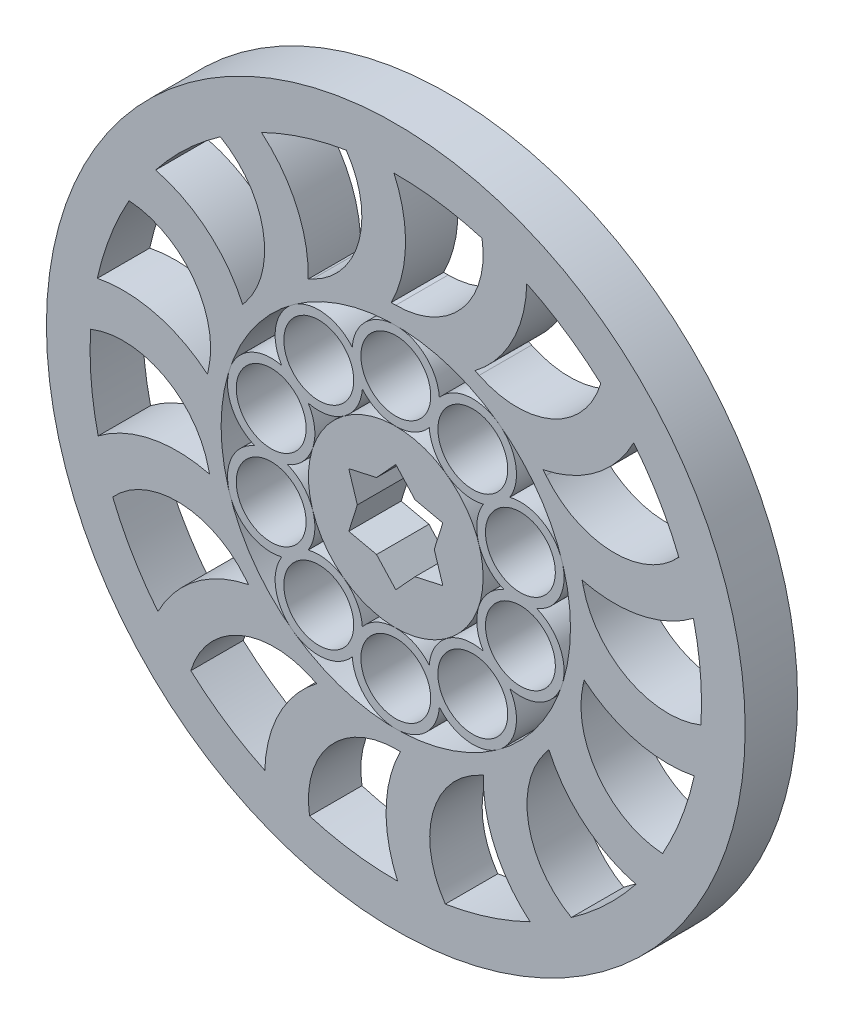
from build123d import *

# Parameters (mm, degrees)
SKETCH2_R           = 10
SKETCH2_R_2         = 1
BOSS_EXTRUDE2_DEPTH = 6
SKETCH3_R           = 5
SKETCH3_R_2         = 4
BOSS_EXTRUDE3_DEPTH = 6
CIRPATTERN1_COUNT   = 10
SKETCH5_R           = 22
SKETCH5_R_2         = 20
BOSS_EXTRUDE4_DEPTH = 6
SKETCH6_R           = 40
SKETCH6_R_2         = 35
BOSS_EXTRUDE5_DEPTH = 6
BOSS_EXTRUDE6_DEPTH = 6
CAVITY1_OUTLINE_R   = 1
CAVITY1_DEPTH       = 6
CUT_EXTRUDE1_DEPTH  = 6


# Read off the part's stored shape, not the designer's step: Cavity1
with BuildPart() as part:
    # Sketch2 → Boss-Extrude2 (new body)
    with BuildSketch(Plane.XY):
        Circle(SKETCH2_R)
        Circle(SKETCH2_R_2, mode=Mode.SUBTRACT)
    extrude(amount=BOSS_EXTRUDE2_DEPTH)

    # Cavity1 outline → Cavity1 (cut)
    with BuildSketch(Plane.XY):
        Polygon((5.127518984, -2.960374466), (4.194116501, 0), (5.127518984, 2.960374466), (2.09705825, 3.632211436), (0, 5.920748932), (-2.09705825, 3.632211436), (-5.127518984, 2.960374466), (-4.194116501, 0), (-5.127518984, -2.960374466), (-2.09705825, -3.632211436), (0, -5.920748932), (2.09705825, -3.632211436), align=None)
        Circle(CAVITY1_OUTLINE_R, mode=Mode.SUBTRACT)
    extrude(amount=CAVITY1_DEPTH, mode=Mode.SUBTRACT)

    # Sketch8 → Cut-Extrude1 (cut)
    # profile 1 of 2: a face of its own
    with BuildSketch(Plane(origin=(0, 0, 0), x_dir=(-1, 0, 0), z_dir=(0, 0, -1))):
        Polygon((5.383894933, -3.108393189), (4.403822326, 0), (5.383894933, 3.108393189), (2.201911163, 3.813822008), (0, 6.216786378), (-2.201911163, 3.813822008), (-5.383894933, 3.108393189), (-4.403822326, 0), (-5.383894933, -3.108393189), (-2.201911163, -3.813822008), (0, -6.216786378), (2.201911163, -3.813822008), align=None)
        Polygon((-2.09705825, -3.632211436), (-5.127518984, -2.960374466), (-4.194116501, 0), (-5.127518984, 2.960374466), (-2.09705825, 3.632211436), (0, 5.920748932), (2.09705825, 3.632211436), (5.127518984, 2.960374466), (4.194116501, 0), (5.127518984, -2.960374466), (2.09705825, -3.632211436), (0, -5.920748932), align=None, mode=Mode.SUBTRACT)
    # profile 2 of 2: a face of its own
    with BuildSketch(Plane(origin=(0, 0, 0), x_dir=(-1, 0, 0), z_dir=(0, 0, -1))):
        Polygon((-5.127518984, -2.960374466), (-4.194116501, 0), (-5.127518984, 2.960374466), (-2.09705825, 3.632211436), (0, 5.920748932), (2.09705825, 3.632211436), (5.127518984, 2.960374466), (4.194116501, 0), (5.127518984, -2.960374466), (2.09705825, -3.632211436), (0, -5.920748932), (-2.09705825, -3.632211436), align=None)
    extrude(amount=-CUT_EXTRUDE1_DEPTH, mode=Mode.SUBTRACT)


with BuildPart() as body_2:
    # Sketch3 → Boss-Extrude3 (new body)
    with BuildSketch(Plane.XY):
        with Locations((0, 15)):
            Circle(SKETCH3_R)
        with Locations((0, 15)):
            Circle(SKETCH3_R_2, mode=Mode.SUBTRACT)
    boss_extrude3 = extrude(amount=BOSS_EXTRUDE3_DEPTH)

    # CirPattern1: Boss-Extrude3 ×10 about axis
    cirpattern1_axis = Axis((0, 0, 0), (0, 0, 1))
    for i in range(1, CIRPATTERN1_COUNT):
        add(boss_extrude3.rotate(cirpattern1_axis, i * 360 / CIRPATTERN1_COUNT))


with BuildPart() as body_3:
    # Sketch5 → Boss-Extrude4 (new body)
    with BuildSketch(Plane.XY):
        Circle(SKETCH5_R)
        Circle(SKETCH5_R_2, mode=Mode.SUBTRACT)
    extrude(amount=BOSS_EXTRUDE4_DEPTH)



with BuildPart() as body_4:
    # Sketch6 → Boss-Extrude5 (new body)
    with BuildSketch(Plane.XY):
        Circle(SKETCH6_R)
        Circle(SKETCH6_R_2, mode=Mode.SUBTRACT)
    extrude(amount=BOSS_EXTRUDE5_DEPTH)


with BuildPart() as body_3_1:
    add(body_3.part)

    add(body_4.part)  # Boss-Extrude6 merges body 4
    # Sketch7 → Boss-Extrude6 (add)
    with BuildSketch(Plane.XY):
        with BuildLine():
            ThreePointArc((0, 22), (7.608588897, 25.510826324), (9.874690956, 33.578125))
            ThreePointArc((9.874690956, 33.578125), (12.473288788, 32.70194286), (14.995311767, 31.625))
            ThreePointArc((14.995311767, 31.625), (13.349298508, 25.159223045), (9.062163248, 20.046875))
            ThreePointArc((9.062163248, 20.046875), (4.635124054, 21.506176438), (0, 22))
        make_face()
        with BuildLine():
            ThreePointArc((16.862740045, 14.129684999), (13.507282719, 17.365290483), (9.545442261, 19.821315094))
            ThreePointArc((9.545442261, 19.821315094), (17.923834438, 19.683217312), (23.465791559, 25.968377433))
            ThreePointArc((23.465791559, 25.968377433), (25.426886123, 24.051475258), (27.231882316, 21.986918509))
            ThreePointArc((27.231882316, 21.986918509), (22.943480132, 16.875633153), (16.862740045, 14.129684999))
        make_face()
        with BuildLine():
            ThreePointArc((21.323444368, 5.413937595), (19.704158385, 9.784995775), (17.200292614, 13.716775641))
            ThreePointArc((17.200292614, 13.716775641), (24.689044747, 9.957105713), (32.409204355, 13.215274234))
            ThreePointArc((32.409204355, 13.215274234), (33.344376821, 10.63731801), (34.074844596, 7.994058155))
            ThreePointArc((34.074844596, 7.994058155), (27.993424133, 5.249617149), (21.323444368, 5.413937595))
        make_face()
        with BuildLine():
            ThreePointArc((21.560779019, -4.374106547), (21.998383828, 0.26666265), (21.448414068, 4.895460547))
            ThreePointArc((21.448414068, 4.895460547), (26.564286953, -1.741132788), (34.933576755, -2.155276102))
            ThreePointArc((34.933576755, -2.155276102), (34.657604747, -4.883690529), (34.168866002, -7.582123457))
            ThreePointArc((34.168866002, -7.582123457), (27.498927167, -7.416149914), (21.560779019, -4.374106547))
        make_face()
        with BuildLine():
            ThreePointArc((17.52773696, -13.295805243), (19.935559561, -9.304486284), (21.448414068, -4.895460547))
            ThreePointArc((21.448414068, -4.895460547), (23.178146338, -13.094518587), (30.538925847, -17.098947573))
            ThreePointArc((30.538925847, -17.098947573), (29.106469006, -19.437424263), (27.495324443, -21.65657253))
            ThreePointArc((27.495324443, -21.65657253), (21.557930424, -18.613057533), (17.52773696, -13.295805243))
        make_face()
        with BuildLine():
            ThreePointArc((10.023111632, -19.584106648), (13.924253229, -17.032767597), (17.200292614, -13.716775641))
            ThreePointArc((17.200292614, -13.716775641), (15.20128958, -21.854374387), (20.095666139, -28.655962772))
            ThreePointArc((20.095666139, -28.655962772), (17.790440111, -30.141337738), (15.37599667, -31.441671813))
            ThreePointArc((15.37599667, -31.441671813), (11.34712117, -26.123420834), (10.023111632, -19.584106648))
        make_face()
        with BuildLine():
            ThreePointArc((0.53328612, -21.993535548), (5.155077775, -21.387500395), (9.545442261, -19.821315094))
            ThreePointArc((9.545442261, -19.821315094), (4.213630989, -26.285703312), (5.672213296, -34.537313102))
            ThreePointArc((5.672213296, -34.537313102), (2.950796366, -34.875389615), (0.211264183, -34.999362386))
            ThreePointArc((0.211264183, -34.999362386), (-1.111124596, -28.459720256), (0.53328612, -21.993535548))
        make_face()
        with BuildLine():
            ThreePointArc((-9.062163248, -20.046875), (-4.635124054, -21.506176438), (0, -22))
            ThreePointArc((0, -22), (-7.608588897, -25.510826324), (-9.874690956, -33.578125))
            ThreePointArc((-9.874690956, -33.578125), (-12.473288788, -32.70194286), (-14.995311767, -31.625))
            ThreePointArc((-14.995311767, -31.625), (-13.349298508, -25.159223045), (-9.062163248, -20.046875))
        make_face()
        with BuildLine():
            ThreePointArc((-16.862740045, -14.129684999), (-13.507282719, -17.365290483), (-9.545442261, -19.821315094))
            ThreePointArc((-9.545442261, -19.821315094), (-17.923834438, -19.683217312), (-23.465791559, -25.968377433))
            ThreePointArc((-23.465791559, -25.968377433), (-25.426886123, -24.051475258), (-27.231882316, -21.986918509))
            ThreePointArc((-27.231882316, -21.986918509), (-22.943480132, -16.875633153), (-16.862740045, -14.129684999))
        make_face()
        with BuildLine():
            ThreePointArc((-21.323444368, -5.413937595), (-19.704158385, -9.784995775), (-17.200292614, -13.716775641))
            ThreePointArc((-17.200292614, -13.716775641), (-24.689044747, -9.957105713), (-32.409204355, -13.215274234))
            ThreePointArc((-32.409204355, -13.215274234), (-33.344376821, -10.63731801), (-34.074844596, -7.994058155))
            ThreePointArc((-34.074844596, -7.994058155), (-27.993424133, -5.249617149), (-21.323444368, -5.413937595))
        make_face()
        with BuildLine():
            ThreePointArc((-21.560779019, 4.374106547), (-21.998383828, -0.26666265), (-21.448414068, -4.895460547))
            ThreePointArc((-21.448414068, -4.895460547), (-26.564286953, 1.741132788), (-34.933576755, 2.155276102))
            ThreePointArc((-34.933576755, 2.155276102), (-34.657604747, 4.883690529), (-34.168866002, 7.582123457))
            ThreePointArc((-34.168866002, 7.582123457), (-27.498927167, 7.416149914), (-21.560779019, 4.374106547))
        make_face()
        with BuildLine():
            ThreePointArc((-17.52773696, 13.295805243), (-19.935559561, 9.304486284), (-21.448414068, 4.895460547))
            ThreePointArc((-21.448414068, 4.895460547), (-23.178146338, 13.094518587), (-30.538925847, 17.098947573))
            ThreePointArc((-30.538925847, 17.098947573), (-29.106469006, 19.437424263), (-27.495324443, 21.65657253))
            ThreePointArc((-27.495324443, 21.65657253), (-21.557930424, 18.613057533), (-17.52773696, 13.295805243))
        make_face()
        with BuildLine():
            ThreePointArc((-10.023111632, 19.584106648), (-13.924253229, 17.032767597), (-17.200292614, 13.716775641))
            ThreePointArc((-17.200292614, 13.716775641), (-15.20128958, 21.854374387), (-20.095666139, 28.655962772))
            ThreePointArc((-20.095666139, 28.655962772), (-17.790440111, 30.141337738), (-15.37599667, 31.441671813))
            ThreePointArc((-15.37599667, 31.441671813), (-11.34712117, 26.123420834), (-10.023111632, 19.584106648))
        make_face()
        with BuildLine():
            ThreePointArc((-0.53328612, 21.993535548), (-5.155077775, 21.387500395), (-9.545442261, 19.821315094))
            ThreePointArc((-9.545442261, 19.821315094), (-4.213630989, 26.285703312), (-5.672213296, 34.537313102))
            ThreePointArc((-5.672213296, 34.537313102), (-2.950796366, 34.875389615), (-0.211264183, 34.999362386))
            ThreePointArc((-0.211264183, 34.999362386), (1.111124596, 28.459720256), (-0.53328612, 21.993535548))
        make_face()
    extrude(amount=BOSS_EXTRUDE6_DEPTH)


solid = Compound([part.part, body_2.part, body_3_1.part])
